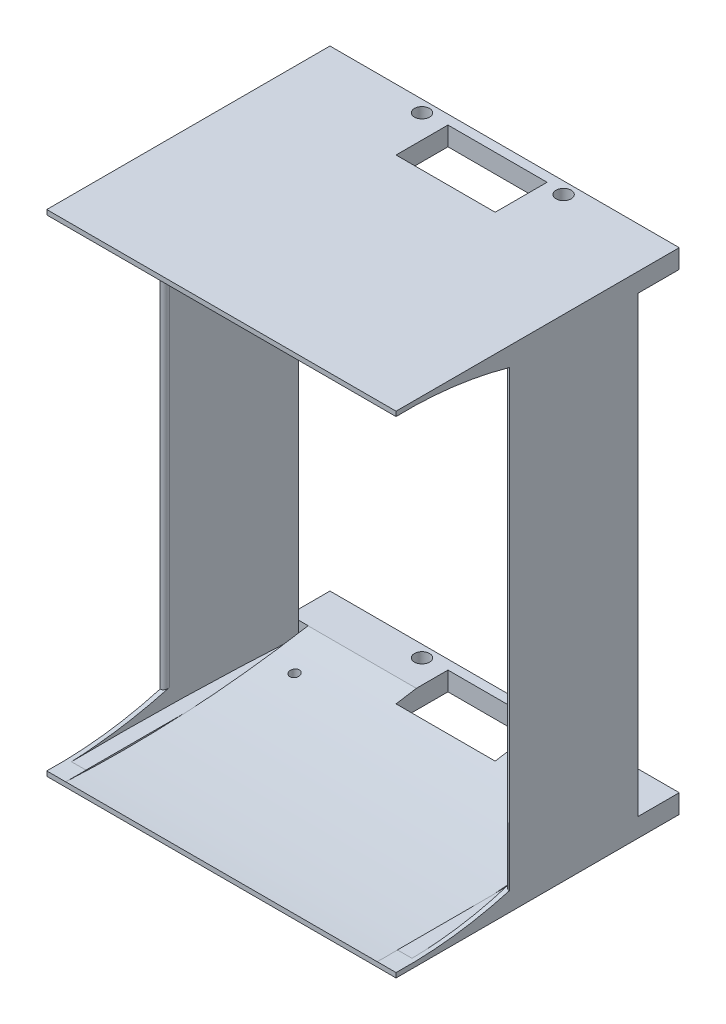
from build123d import *

# Parameters (mm, degrees)
SKETCH1_W           = 74
SKETCH1_H           = 104
BOSS_EXTRUDE1_DEPTH = 40
SKETCH2_W           = 66
SKETCH2_H           = 96
CUT_EXTRUDE1_DEPTH  = 40
SKETCH3_R           = 1.6
CUT_EXTRUDE2_DEPTH  = 118.409539646
SKETCH4_W           = 8.7
SKETCH4_H           = 96
CUT_EXTRUDE3_DEPTH  = 99.893882521
SKETCH5_R           = 1
CUT_EXTRUDE4_DEPTH  = 3.5
SKETCH9_W           = 74
SKETCH9_H           = 4
BOSS_EXTRUDE2_DEPTH = 20
CUT_EXTRUDE7_DEPTH  = 66
SKETCH8_W           = 21
SKETCH8_H           = 11
CUT_EXTRUDE10_DEPTH = 126.638369983
SKETCH16_W          = 74
SKETCH16_H          = 96
CUT_EXTRUDE11_DEPTH = 6
CUT_EXTRUDE13_DEPTH = 109.535708513
CUT_EXTRUDE14_DEPTH = 51
FILLET3_R           = 1


with BuildPart() as part:
    # Sketch1 → Boss-Extrude1 (new body)
    with BuildSketch(Plane.XY):
        Rectangle(SKETCH1_W, SKETCH1_H)
    extrude(amount=BOSS_EXTRUDE1_DEPTH)

    # Sketch2 → Cut-Extrude1 (cut)
    with BuildSketch(Plane.XY.offset(40)):
        Rectangle(SKETCH2_W, SKETCH2_H)
    extrude(amount=-CUT_EXTRUDE1_DEPTH, mode=Mode.SUBTRACT)

    # Sketch3 → Cut-Extrude2 (cut, through all)
    with BuildSketch(Plane.XZ.offset(52)):
        with Locations((-15, 2.5)):
            Circle(SKETCH3_R)
        with Locations((15, 2.5)):
            Circle(SKETCH3_R)
    extrude(amount=-CUT_EXTRUDE2_DEPTH, mode=Mode.SUBTRACT)

    # Sketch4 → Cut-Extrude3 (cut, through all)
    with BuildSketch(Plane.ZY.offset(37)):
        with Locations((4.35, 0)):
            Rectangle(SKETCH4_W, SKETCH4_H)
    extrude(amount=-CUT_EXTRUDE3_DEPTH, mode=Mode.SUBTRACT)

    # Sketch5 → Cut-Extrude4 (cut)
    with BuildSketch(Plane.XZ.offset(52)):
        with Locations((-27, 9)):
            Circle(SKETCH5_R)
        with Locations((-27, 17.5)):
            Circle(SKETCH5_R)
        with Locations(Location((27, 9, 0), (0, 0, 180))):
            Circle(SKETCH5_R)
        with Locations(Location((27, 17.5, 0), (0, 0, 180))):
            Circle(SKETCH5_R)
    extrude(amount=-CUT_EXTRUDE4_DEPTH, mode=Mode.SUBTRACT)

    # Sketch9 → Boss-Extrude2 (add)
    with BuildSketch(Plane.XY.offset(40)):
        with Locations((0, -50)):
            Rectangle(SKETCH9_W, SKETCH9_H)
        with Locations((0, 50)):
            Rectangle(SKETCH9_W, SKETCH9_H)
    extrude(amount=BOSS_EXTRUDE2_DEPTH)

    # Sketch11 → Cut-Extrude7 (cut)
    with BuildSketch(Plane(origin=(-33, 0, 0), x_dir=(0, 0, -1), z_dir=(1, 0, 0))):
        with BuildLine():
            Line((-60, -48), (-8.7, -48))
            ThreePointArc((-8.7, -48), (-34.265026612, -50.953044928), (-60, -51))
            Line((-60, -51), (-60, -48))
        make_face()
        with BuildLine():
            Line((-60, 48), (-60, 51))
            ThreePointArc((-60, 51), (-34.265026612, 50.953044928), (-8.7, 48))
            Line((-8.7, 48), (-60, 48))
        make_face()
    extrude(amount=CUT_EXTRUDE7_DEPTH, mode=Mode.SUBTRACT)

    # Sketch8 → Cut-Extrude10 (cut, through all)
    with BuildSketch(Plane.XZ.offset(52)):
        with Locations((0.5, 7.5)):
            Rectangle(SKETCH8_W, SKETCH8_H)
    extrude(amount=-CUT_EXTRUDE10_DEPTH, mode=Mode.SUBTRACT)

    # Sketch16 → Cut-Extrude11 (cut)
    with BuildSketch(Plane.XY.offset(42)):
        Rectangle(SKETCH16_W, SKETCH16_H)
    extrude(amount=-CUT_EXTRUDE11_DEPTH, mode=Mode.SUBTRACT)

    # Sketch18 → Cut-Extrude13 (cut, through all)
    with BuildSketch(Plane(origin=(37, 0, 0), x_dir=(0, 0, -1), z_dir=(1, 0, 0))):
        with BuildLine():
            Line((-60, 51), (-60, 48))
            Line((-60, 48), (-36, 48))
            ThreePointArc((-36, 48), (-47.886451631, 50.40838695), (-60, 51))
        make_face()
        with BuildLine():
            Line((-60, -48), (-36, -48))
            ThreePointArc((-36, -48), (-47.886451631, -50.40838695), (-60, -51))
            Line((-60, -51), (-60, -48))
        make_face()
    extrude(amount=-CUT_EXTRUDE13_DEPTH, mode=Mode.SUBTRACT)

    # Sketch20 → Cut-Extrude14 (cut, symmetric)
    with BuildSketch(Plane(origin=(0, 0, 0), x_dir=(1, 0, 0), z_dir=(0, 1, 0))):
        with BuildLine():
            Line((-36, -60), (-33, -60))
            Line((-33, -60), (-32.94530899, -59.042459963))
            Line((-32.94530899, -59.042459963), (-32.94530899, -8.667965125))
            Line((-32.94530899, -8.667965125), (-35, -8.667965125))
            ThreePointArc((-35, -8.667965125), (-36.011139943, -34.324025039), (-36, -60))
        make_face()
        with BuildLine():
            Line((32.94530899, -8.667965125), (32.94530899, -59.042459963))
            Line((32.94530899, -59.042459963), (33, -60))
            Line((33, -60), (36, -60))
            ThreePointArc((36, -60), (36.011139943, -34.324025039), (35, -8.667965125))
            Line((35, -8.667965125), (32.94530899, -8.667965125))
        make_face()
    extrude(amount=CUT_EXTRUDE14_DEPTH, both=True, mode=Mode.SUBTRACT)

    # Fillet3
    # the kernel refuses this fillet: 1 mm, written as the material it takes off along each edge
    with BuildSketch(Plane(origin=(36.041610271, -50.456283498, 36), x_dir=(1, 0, 0), z_dir=(0, 1, 0))) as fillet3_piece_1_section:
        with BuildLine():
            CenterArc((0.982513399, 1), FILLET3_R, 181.05432328, 88.94567672)
            ThreePointArc((-0.017317299, 0.981599626), (-0.008471821, 0.490803109), (0, 0))
            Line((0, 0), (0.982513399, 0))
        make_face()
    fillet3_piece_1 = extrude(amount=100.912566997, mode=Mode.PRIVATE)
    fillet3_piece_1 = fillet3_piece_1 & Plane(origin=(36.2601728, -29.307183003, 57.850897875), x_dir=(0, 0.9622989266780244, -0.27199407293969147), z_dir=(1, 0, 0)) * Cylinder(80.335933938, 206, mode=Mode.PRIVATE)
    fillet3_piece_1 = fillet3_piece_1 & Plane(origin=(36.2601728, 29.307183003, 57.850897875), x_dir=(0, -0.9622989266780254, -0.27199407293968814), z_dir=(1, 0, 0)) * Cylinder(80.335933938, 206, mode=Mode.PRIVATE)
    add(fillet3_piece_1, mode=Mode.SUBTRACT)
    with BuildSketch(Plane(origin=(-36.041610271, -50.456283498, 36), x_dir=(-1, 0, 0), z_dir=(0, 1, 0))) as fillet3_piece_2_section:
        with BuildLine():
            CenterArc((0.982513399, -1), FILLET3_R, 90, 88.94567672)
            ThreePointArc((-0.017317299, -0.981599626), (-0.008471821, -0.490803109), (0, 0))
            Line((0, 0), (0.982513399, 0))
        make_face()
    fillet3_piece_2 = extrude(amount=100.912566997, mode=Mode.PRIVATE)
    fillet3_piece_2 = fillet3_piece_2 & Plane(origin=(-36.2601728, -29.307183003, 57.850897875), x_dir=(0, 0.9622989266780244, -0.27199407293969147), z_dir=(1, 0, 0)) * Cylinder(80.335933938, 206, mode=Mode.PRIVATE)
    fillet3_piece_2 = fillet3_piece_2 & Plane(origin=(-36.2601728, 29.307183003, 57.850897875), x_dir=(0, -0.9622989266780254, -0.27199407293968814), z_dir=(1, 0, 0)) * Cylinder(80.335933938, 206, mode=Mode.PRIVATE)
    add(fillet3_piece_2, mode=Mode.SUBTRACT)


solid = part.part
